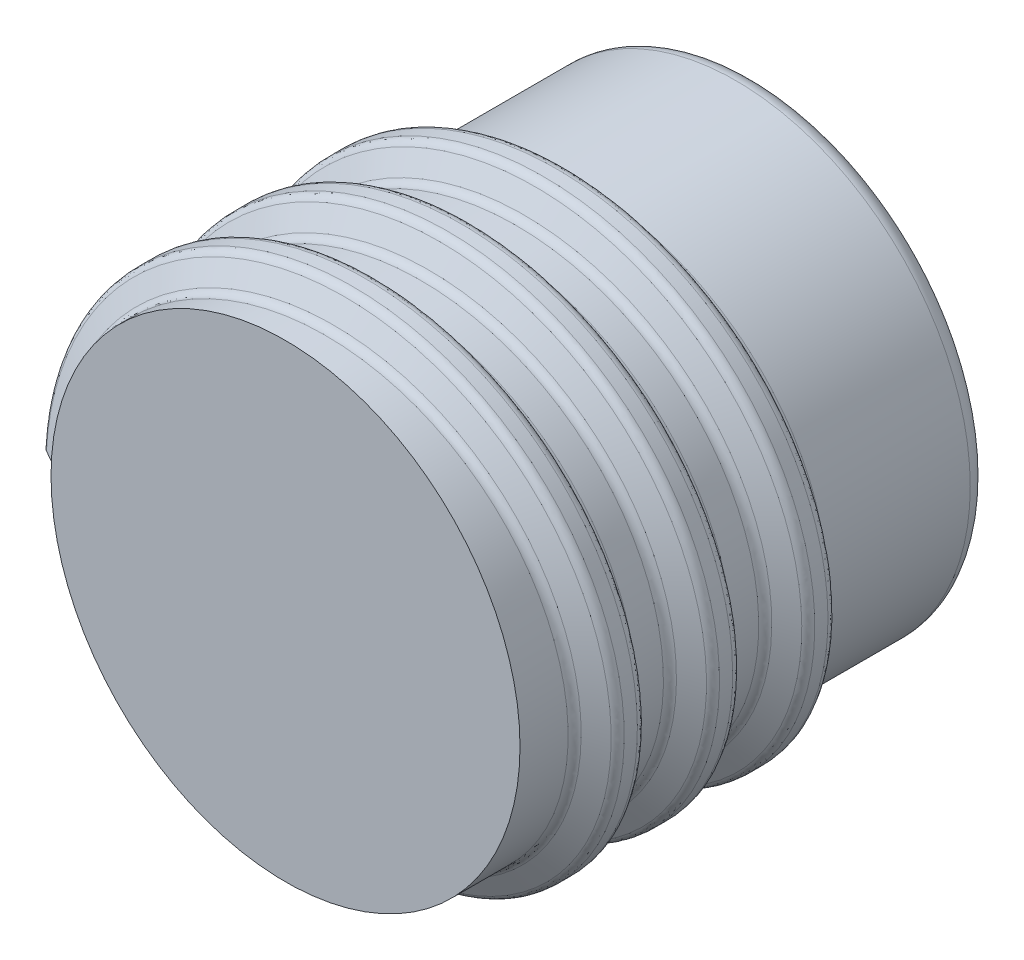
from build123d import *

# Parameters (mm, degrees)
SKIZZE1_R                       = 12.5
AUFSATZ_LINEAR_AUSTRAGEN1_DEPTH = 25
GEWINDE2_PITCH                  = 5.08
VERRUNDUNG1_R                   = 1


with BuildPart() as part:
    # Skizze1 → Aufsatz-Linear austragen1 (new body)
    with BuildSketch(Plane.XY):
        with Locations(Location((0, 0, 0), (0, 0, 180))):
            Circle(SKIZZE1_R)
    extrude(amount=AUFSATZ_LINEAR_AUSTRAGEN1_DEPTH)

    # Gewinde2: the profile of Gewindeprofil2 profile screwed along a right-hand helix of 2.952756 turns, 12 arcs to a turn; built about Z, then put on its axis
    gewinde2_z = Axis((0, 0, 0), (0, 0, 1))
    gewinde2_corners = [(12.4997, 0, 0), (12.4997, 0, 3.634587873), (12.5, 0, 3.634587873), (12.754, 0, 3.194646968), (13.77, 0, 2.608059095), (14.024, 0, 2.16811819), (14.024, 0, 1.466469684), (13.77, 0, 1.026528779), (12.754, 0, 0.439940905), (12.5, 0, 0)]
    with BuildLine(mode=Mode.PRIVATE) as gewinde2_profile:
        Line(gewinde2_corners[0], gewinde2_corners[1])
        Line(gewinde2_corners[3], gewinde2_corners[4])
        Line(gewinde2_corners[5], gewinde2_corners[6])
        Line(gewinde2_corners[7], gewinde2_corners[8])
        Line(gewinde2_corners[9], gewinde2_corners[0])
        Line(gewinde2_corners[2], gewinde2_corners[1])
        ThreePointArc((12.5, 0, 3.634587873), (12.568059095, 0, 3.380587873), (12.754, 0, 3.194646968))
        ThreePointArc((13.77, 0, 2.608059095), (13.955940905, 0, 2.42211819), (14.024, 0, 2.16811819))
        ThreePointArc((14.024, 0, 1.466469684), (13.955940905, 0, 1.212469684), (13.77, 0, 1.026528779))
        ThreePointArc((12.754, 0, 0.439940905), (12.568059095, 0, 0.254), (12.5, 0, 0))
    gewinde2_cap = Face(gewinde2_profile.wire())
    gewinde2_arcs = [((12.5, 0, 3.634587873), (12.5, 0, 3.341293937), (12.754, 0, 3.194646968), (1, 0.866025403784437, 1)), ((13.77, 0, 2.608059095), (14.024, 0, 2.461412127), (14.024, 0, 2.16811819), (1, 0.8660254037844378, 1)), ((14.024, 0, 1.466469684), (14.024, 0, 1.173175747), (13.77, 0, 1.026528779), (1, 0.8660254037844376, 1)), ((12.754, 0, 0.439940905), (12.5, 0, 0.293293937), (12.5, 0, 0), (1, 0.8660254037844366, 1))]  # start, shoulder, end, weights
    gewinde2_turn_angles = [0, 15, 30, 45, 60, 75, 90, 105, 120, 135, 150, 165, 180, 195, 210, 225, 240, 255, 270, 285, 300, 315, 330, 345, 360]
    gewinde2_turn_weights = [1, 0.9659258262890683, 1, 0.9659258262890683, 1, 0.9659258262890683, 1, 0.9659258262890683, 1, 0.9659258262890683, 1, 0.9659258262890683, 1, 0.9659258262890683, 1, 0.9659258262890683, 1, 0.9659258262890683, 1, 0.9659258262890683, 1, 0.9659258262890683, 1, 0.9659258262890683, 1]
    gewinde2_turn_rails = [Edge.make_bspline([Vector(p[0], p[1], 0).rotate(gewinde2_z, gewinde2_turn_angles[k]) / gewinde2_turn_weights[k] + Vector(0, 0, p[2] + GEWINDE2_PITCH * gewinde2_turn_angles[k] / 360) for k in range(25)], [0, 0, 0, 1, 1, 2, 2, 3, 3, 4, 4, 5, 5, 6, 6, 7, 7, 8, 8, 9, 9, 10, 10, 11, 11, 12, 12, 12], 2, gewinde2_turn_weights) for p in gewinde2_corners]
    gewinde2_turn_sides = [*[Face.make_surface_from_curves(gewinde2_turn_rails[p[0]], gewinde2_turn_rails[p[1]]) for p in [(0, 1), (3, 4), (5, 6), (7, 8), (9, 0), (2, 1)]], *[Face.make_bezier_surface([[Vector(p[j][0], p[j][1], 0).rotate(gewinde2_z, gewinde2_turn_angles[2 * i + k]) / gewinde2_turn_weights[2 * i + k] + Vector(0, 0, p[j][2] + GEWINDE2_PITCH * gewinde2_turn_angles[2 * i + k] / 360) for k in range(3)] for j in range(3)], [[p[3][j] * gewinde2_turn_weights[2 * i + k] for k in range(3)] for j in range(3)]) for p in gewinde2_arcs for i in range(12)]]
    gewinde2_last_angles = [720, 735, 750, 765, 780, 795, 810, 825, 840, 855, 870, 885, 900, 915, 930, 945, 960, 975, 990, 1005, 1020, 1035, 1050, 1056.496062992, 1062.992125984]
    gewinde2_last_weights = [1, 0.9659258262890683, 1, 0.9659258262890683, 1, 0.9659258262890683, 1, 0.9659258262890683, 1, 0.9659258262890683, 1, 0.9659258262890683, 1, 0.9659258262890683, 1, 0.9659258262890683, 1, 0.9659258262890683, 1, 0.9659258262890683, 1, 0.9659258262890683, 1, 0.9935796319483061, 1]
    gewinde2_last_rails = [Edge.make_bspline([Vector(p[0], p[1], 0).rotate(gewinde2_z, gewinde2_last_angles[k]) / gewinde2_last_weights[k] + Vector(0, 0, p[2] + GEWINDE2_PITCH * gewinde2_last_angles[k] / 360) for k in range(25)], [0, 0, 0, 1, 1, 2, 2, 3, 3, 4, 4, 5, 5, 6, 6, 7, 7, 8, 8, 9, 9, 10, 10, 11, 11, 12, 12, 12], 2, gewinde2_last_weights) for p in gewinde2_corners]
    gewinde2_last_sides = [*[Face.make_surface_from_curves(gewinde2_last_rails[p[0]], gewinde2_last_rails[p[1]]) for p in [(0, 1), (3, 4), (5, 6), (7, 8), (9, 0), (2, 1)]], *[Face.make_bezier_surface([[Vector(p[j][0], p[j][1], 0).rotate(gewinde2_z, gewinde2_last_angles[2 * i + k]) / gewinde2_last_weights[2 * i + k] + Vector(0, 0, p[j][2] + GEWINDE2_PITCH * gewinde2_last_angles[2 * i + k] / 360) for k in range(3)] for j in range(3)], [[p[3][j] * gewinde2_last_weights[2 * i + k] for k in range(3)] for j in range(3)]) for p in gewinde2_arcs for i in range(12)]]
    gewinde2 = Plane(origin=(0, 0, 25), x_dir=(-1, 0, 0), z_dir=(0, 0, -1)) * Solid(Shell([*[p.moved(Location((0, 0, GEWINDE2_PITCH * i))) for i in range(2) for p in gewinde2_turn_sides], *gewinde2_last_sides, gewinde2_cap, gewinde2_cap.rotate(gewinde2_z, 1062.992125984).moved(Location((0, 0, GEWINDE2_PITCH * 1062.992125984 / 360)))]))
    add(gewinde2)

    # Verrundung1
    verrundung1_edges = [part.edges().sort_by_distance(p)[0] for p in [
        (12.5, 0, 0),
    ]]
    fillet(verrundung1_edges, radius=VERRUNDUNG1_R)


solid = part.part
